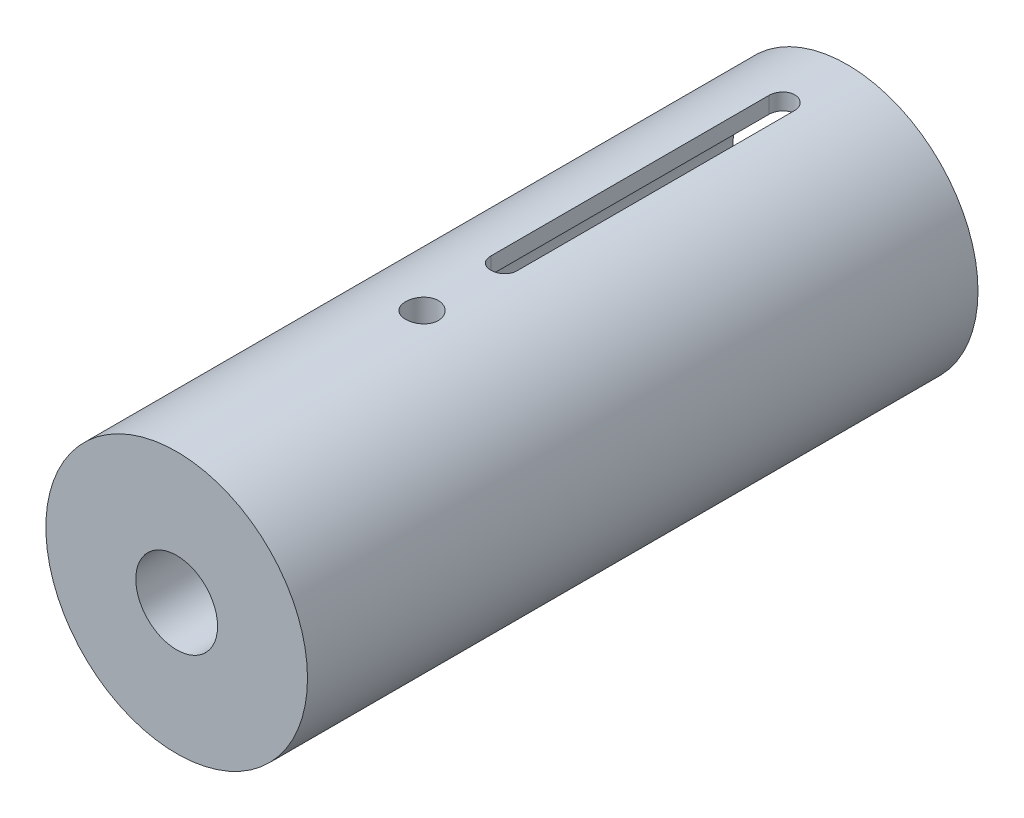
from build123d import *

# Parameters (mm, degrees)
SKETCH1_R               = 8
SKETCH1_R_2             = 7
BOSS_EXTRUDE1_DEPTH     = 41
CUT_EXTRUDE1_DEPTH      = 43.532340636
CUT_EXTRUDE1_DEPTH_BACK = 43.532340636
BOSS_EXTRUDE2_START     = -17
SKETCH3_R               = 7
SKETCH3_R_2             = 2.5
BOSS_EXTRUDE2_DEPTH     = 17
SKETCH4_R               = 1
CUT_EXTRUDE2_DEPTH      = 17


with BuildPart() as part:
    # Sketch1 → Boss-Extrude1 (new body)
    with BuildSketch(Plane.XY):
        Circle(SKETCH1_R)
        Circle(SKETCH1_R_2, mode=Mode.SUBTRACT)
    extrude(amount=BOSS_EXTRUDE1_DEPTH)

    # Sketch2 → Cut-Extrude1 (cut, two sides: drawn at the far end of the back side and taken through both)
    with BuildSketch(Plane(origin=(0, 0, 0), x_dir=(1, 0, 0), z_dir=(0, 1, 0)).offset(-CUT_EXTRUDE1_DEPTH_BACK)):
        with BuildLine():
            Line((-0.79375, -4), (-0.79375, -21))
            ThreePointArc((-0.79375, -21), (0, -21.79375), (0.79375, -21))
            Line((0.79375, -21), (0.79375, -4))
            ThreePointArc((0.79375, -4), (0, -3.20625), (-0.79375, -4))
        make_face()
    extrude(amount=CUT_EXTRUDE1_DEPTH + CUT_EXTRUDE1_DEPTH_BACK, mode=Mode.SUBTRACT)

    # Sketch3 → Boss-Extrude2 (add)
    with BuildSketch(Plane.XY.offset(41).offset(BOSS_EXTRUDE2_START)):
        Circle(SKETCH3_R)
        Circle(SKETCH3_R_2, mode=Mode.SUBTRACT)
    extrude(amount=BOSS_EXTRUDE2_DEPTH)

    # Sketch4 → Cut-Extrude2 (cut)
    with BuildSketch(Plane(origin=(0, 0, 0), x_dir=(1, 0, 0), z_dir=(0, 1, 0))):
        with Locations((0, -26)):
            Circle(SKETCH4_R)
    extrude(amount=CUT_EXTRUDE2_DEPTH, mode=Mode.SUBTRACT)


solid = part.part
